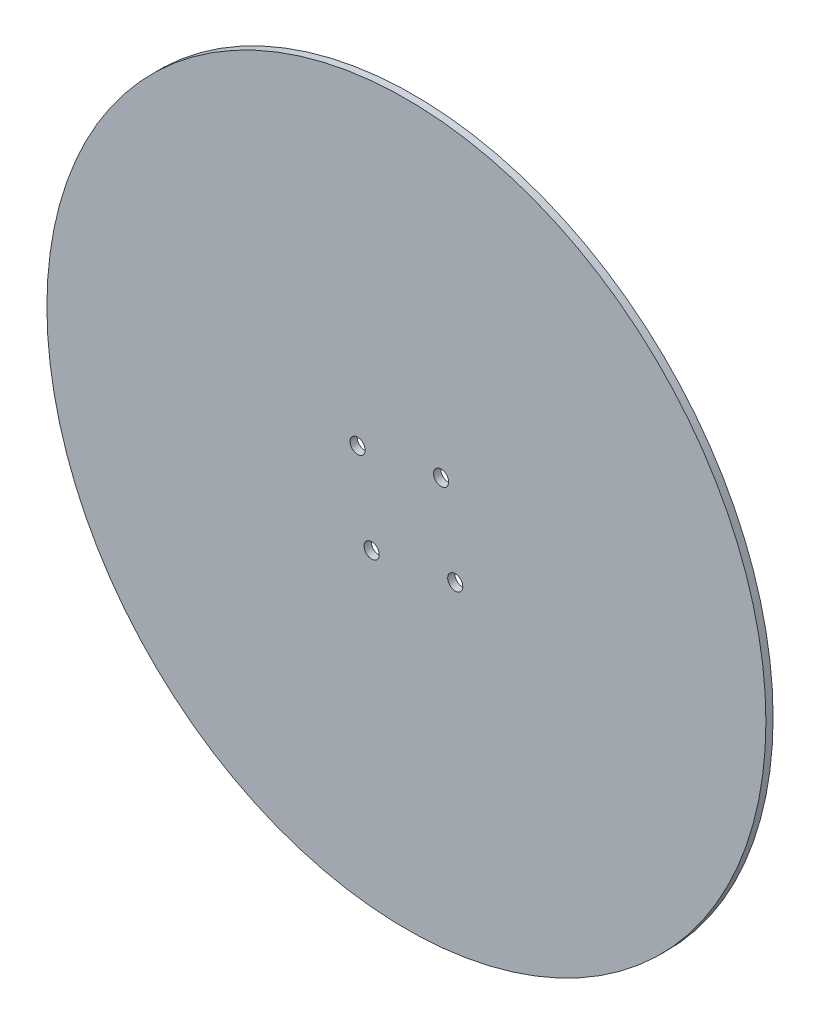
from build123d import *

# Parameters (mm, degrees)
SKETCH1_R           = 150
SKETCH1_R_2         = 3.15
BOSS_EXTRUDE2_DEPTH = 3


with BuildPart() as part:
    # Sketch1 → Boss-Extrude2 (new body)
    with BuildSketch(Plane.XY):
        Circle(SKETCH1_R)
        with Locations((20.373277645, -14.488946062)):
            Circle(SKETCH1_R_2, mode=Mode.SUBTRACT)
        with Locations((-14.488946062, -20.373277645)):
            Circle(SKETCH1_R_2, mode=Mode.SUBTRACT)
        with Locations((-20.373277645, 14.488946062)):
            Circle(SKETCH1_R_2, mode=Mode.SUBTRACT)
        with Locations((14.488946062, 20.373277645)):
            Circle(SKETCH1_R_2, mode=Mode.SUBTRACT)
    extrude(amount=BOSS_EXTRUDE2_DEPTH)


solid = part.part
